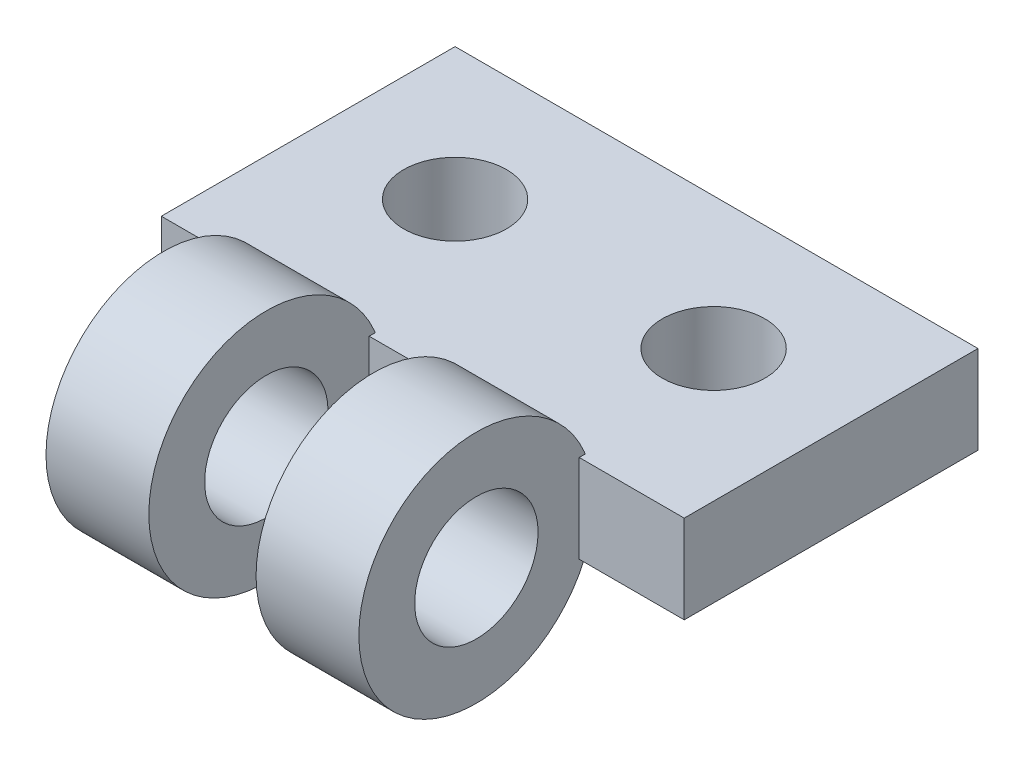
from build123d import *

# Parameters (mm, degrees)
CROQUIS1_R              = 4
CROQUIS1_R_2            = 2.1
SALIENTE_EXTRUIR1_DEPTH = 3.5
MATRIZL3_COUNT          = 2
MATRIZL3_PITCH          = 7.15
CROQUIS4_W              = 17.8
CROQUIS4_H              = 3
SALIENTE_EXTRUIR2_DEPTH = 10
CROQUIS5_R              = 1.75
CORTAR_EXTRUIR1_DEPTH   = 19.097669049


with BuildPart() as part:
    # Croquis1 → Saliente-Extruir1 (new body)
    with BuildSketch(Plane(origin=(0, 0, 0), x_dir=(0, -1, 0), z_dir=(1, 0, 0))):
        Circle(CROQUIS1_R)
        Circle(CROQUIS1_R_2, mode=Mode.SUBTRACT)
    extrude(amount=SALIENTE_EXTRUIR1_DEPTH)


with BuildPart() as matrizl3_1:
    # MatrizL3: pattern copy
    add(part.part.moved(Location(Vector(-1, 0, 0) * (1 * MATRIZL3_PITCH))))


with BuildPart() as body_3:
    # Croquis4 → Saliente-Extruir2 (new body)
    with BuildSketch(Plane.XY.offset(-3.5)):
        with Locations((-1.825, 0)):
            Rectangle(CROQUIS4_W, CROQUIS4_H)
    extrude(amount=-SALIENTE_EXTRUIR2_DEPTH)

    # Croquis5 → Cortar-Extruir1 (cut, through all)
    with BuildSketch(Plane(origin=(0, 1.5, 0), x_dir=(1, 0, 0), z_dir=(0, 1, 0))):
        with Locations((2.575, 9)):
            Circle(CROQUIS5_R)
        with Locations((-6.225, 9)):
            Circle(CROQUIS5_R)
    extrude(amount=-CORTAR_EXTRUIR1_DEPTH, mode=Mode.SUBTRACT)


solid = Compound([part.part, matrizl3_1.part, body_3.part])
